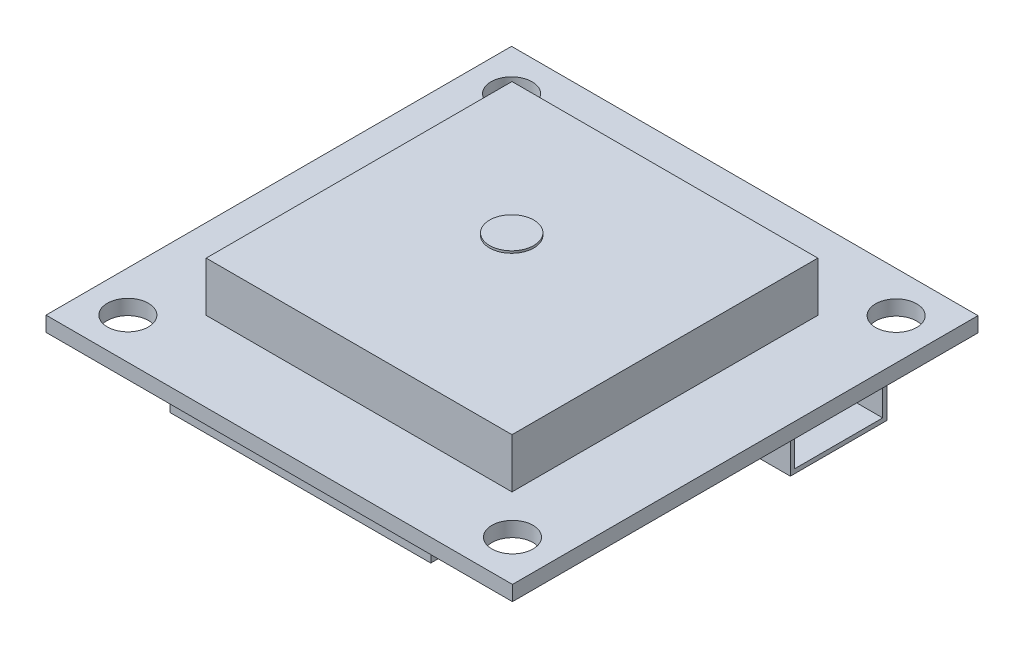
from build123d import *

# Parameters (mm, degrees)
SKETCH1_W           = 38.354
SKETCH1_H           = 38.2778
BOARD_DEPTH         = 1.2319
SKETCH3_W           = 25.146
SKETCH3_H           = 25.146
GPS_DEPTH           = 4.0767
SKETCH5_W           = 21.4376
SKETCH5_H           = 16.7894
UBLOCK_CHIP_DEPTH   = 2.4257
SKETCH6_R           = 3.3782
BATTERY_DEPTH       = 2.1082
SKETCH7_W           = 4.318
SKETCH7_H           = 7.9502
CONNECTOR_DEPTH     = 2.9972
SKETCH8_W           = 7.239
SKETCH8_H           = 2.286
CUT_EXTRUDE1_DEPTH  = 3.7592
CUT_EXTRUDE2_REACH  = 56.352
SKETCH9_R           = 1.6891
SKETCH10_R          = 1.8161
BOSS_EXTRUDE6_DEPTH = 0.1778
SKETCH11_W          = 22.479
SKETCH11_H          = 17.1323
BOSS_EXTRUDE7_DEPTH = 0.762


with BuildPart() as part:
    # Sketch1 → Board (new body)
    with BuildSketch(Plane(origin=(0, 0, 0), x_dir=(1, 0, 0), z_dir=(0, 1, 0))):
        with Locations((19.177, 19.1389)):
            Rectangle(SKETCH1_W, SKETCH1_H)
    extrude(amount=BOARD_DEPTH)

    # Sketch3 → GPS (add)
    with BuildSketch(Plane(origin=(0, 1.2319, 0), x_dir=(1, 0, 0), z_dir=(0, 1, 0))):
        with Locations((19.177, 19.1389)):
            Rectangle(SKETCH3_W, SKETCH3_H)
    extrude(amount=GPS_DEPTH)

    # Sketch5 → uBlock chip (add)
    with BuildSketch(Plane.XZ):
        with Locations((19.1008, -10.2108)):
            Rectangle(SKETCH5_W, SKETCH5_H)
    extrude(amount=UBLOCK_CHIP_DEPTH)

    # Sketch6 → Battery (add)
    with BuildSketch(Plane(origin=(0, 0, 0), x_dir=(-1, 0, 0), z_dir=(0, -1, 0))):
        with Locations((-22.2758, 32.6263)):
            Circle(SKETCH6_R)
    extrude(amount=BATTERY_DEPTH)

    # Sketch7 → Connector (add)
    with BuildSketch(Plane(origin=(0, 0, 0), x_dir=(-1, 0, 0), z_dir=(0, -1, 0))):
        with Locations((-35.687, 27.3304)):
            Rectangle(SKETCH7_W, SKETCH7_H)
    extrude(amount=CONNECTOR_DEPTH)

    # Sketch8 → Cut-Extrude1 (cut)
    with BuildSketch(Plane(origin=(37.846, 0, 0), x_dir=(0, 0, -1), z_dir=(1, 0, 0))):
        with Locations((27.3304, -1.4986)):
            Rectangle(SKETCH8_W, SKETCH8_H)
    extrude(amount=-CUT_EXTRUDE1_DEPTH, mode=Mode.SUBTRACT)

    # Sketch9 → Cut-Extrude2 (cut, up to next)
    with BuildSketch(Plane(origin=(0, 1.2319, 0), x_dir=(1, 0, 0), z_dir=(0, 1, 0)), mode=Mode.PRIVATE) as cut_extrude2_sk1:
        with Locations((34.9885, 3.3655)):
            Circle(SKETCH9_R)
    cut_extrude2_tool1 = extrude(cut_extrude2_sk1.sketch, amount=-CUT_EXTRUDE2_REACH, mode=Mode.PRIVATE) & part.part
    # Sketch9 → Cut-Extrude2 (cut, up to next)
    with BuildSketch(Plane(origin=(0, 1.2319, 0), x_dir=(1, 0, 0), z_dir=(0, 1, 0)), mode=Mode.PRIVATE) as cut_extrude2_sk2:
        with Locations((3.3655, 3.3655)):
            Circle(SKETCH9_R)
    cut_extrude2_tool2 = extrude(cut_extrude2_sk2.sketch, amount=-CUT_EXTRUDE2_REACH, mode=Mode.PRIVATE) & part.part
    # Sketch9 → Cut-Extrude2 (cut, up to next)
    with BuildSketch(Plane(origin=(0, 1.2319, 0), x_dir=(1, 0, 0), z_dir=(0, 1, 0)), mode=Mode.PRIVATE) as cut_extrude2_sk3:
        with Locations((3.3655, 34.9123)):
            Circle(SKETCH9_R)
    cut_extrude2_tool3 = extrude(cut_extrude2_sk3.sketch, amount=-CUT_EXTRUDE2_REACH, mode=Mode.PRIVATE) & part.part
    # Sketch9 → Cut-Extrude2 (cut, up to next)
    with BuildSketch(Plane(origin=(0, 1.2319, 0), x_dir=(1, 0, 0), z_dir=(0, 1, 0)), mode=Mode.PRIVATE) as cut_extrude2_sk4:
        with Locations((34.9885, 34.9123)):
            Circle(SKETCH9_R)
    cut_extrude2_tool4 = extrude(cut_extrude2_sk4.sketch, amount=-CUT_EXTRUDE2_REACH, mode=Mode.PRIVATE) & part.part
    add(cut_extrude2_tool1.solids().sort_by_distance((34.9885, 1.2319, -3.3655))[0], mode=Mode.SUBTRACT)
    add(cut_extrude2_tool2.solids().sort_by_distance((3.3655, 1.2319, -3.3655))[0], mode=Mode.SUBTRACT)
    add(cut_extrude2_tool3.solids().sort_by_distance((3.3655, 1.2319, -34.9123))[0], mode=Mode.SUBTRACT)
    add(cut_extrude2_tool4.solids().sort_by_distance((34.9885, 1.2319, -34.9123))[0], mode=Mode.SUBTRACT)

    # Sketch10 → Boss-Extrude6 (add)
    with BuildSketch(Plane(origin=(0, 5.3086, 0), x_dir=(1, 0, 0), z_dir=(0, 1, 0))):
        with Locations((17.5387, 20.7518)):
            Circle(SKETCH10_R)
    extrude(amount=BOSS_EXTRUDE6_DEPTH)

    # Sketch11 → Boss-Extrude7 (add)
    with BuildSketch(Plane.XZ):
        with Locations((19.1008, -10.2108)):
            Rectangle(SKETCH11_W, SKETCH11_H)
    extrude(amount=BOSS_EXTRUDE7_DEPTH)


solid = part.part
